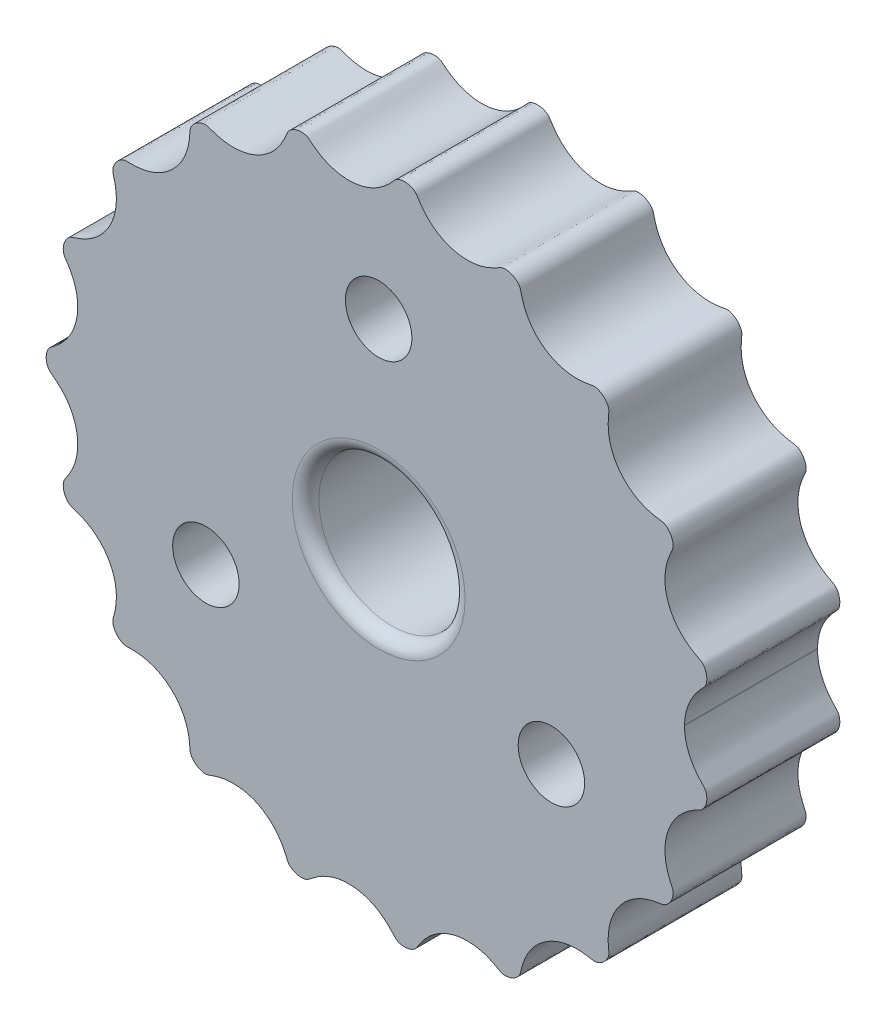
from build123d import *
from OCP.BRepAlgoAPI import BRepAlgoAPI_Cut
from OCP.TopTools import TopTools_ListOfShape

# Parameters (mm, degrees)
SKIZZE1_R                        = 25
AUFSATZ_LINEAR_AUSTRAGEN1_DEPTH  = 10
SCHNITT_LINEAR_AUSTRAGEN1_REACH  = 38.742
SKIZZE3_R                        = 0.5
SKIZZE9_OUTSIDE_W                = 66.282
SKIZZE9_OUTSIDE_H                = 66.277
SCHNITT_LINEAR_AUSTRAGEN6_DEPTH  = 10
SKIZZE21_R                       = 5.5
SCHNITT_LINEAR_AUSTRAGEN11_DEPTH = 10
VERRUNDUNG1_R                    = 1
SKIZZE22_R                       = 2.5
SCHNITT_LINEAR_AUSTRAGEN12_DEPTH = 10


with BuildPart() as part:
    # Skizze1 → Aufsatz-Linear austragen1 (new body)
    with BuildSketch(Plane.XY):
        Circle(SKIZZE1_R)
    extrude(amount=AUFSATZ_LINEAR_AUSTRAGEN1_DEPTH)

    # Skizze3 → Schnitt-Linear austragen1 (cut, up to next)
    with BuildSketch(Plane.XY.offset(10), mode=Mode.PRIVATE) as schnitt_linear_austragen1_sk1:
        with Locations((0, 25)):
            Circle(SKIZZE3_R)
    schnitt_linear_austragen1_tool1 = extrude(schnitt_linear_austragen1_sk1.sketch, amount=-SCHNITT_LINEAR_AUSTRAGEN1_REACH, mode=Mode.PRIVATE) & part.part
    add(schnitt_linear_austragen1_tool1.solids().sort_by_distance((0, 25, 10))[0], mode=Mode.SUBTRACT)


with BuildPart() as schnitt_linear_austragen6_tool:
    # Skizze9 outside → Schnitt-Linear austragen6 (new body)
    with BuildSketch(Plane.XY.offset(10)):
        with Locations((0, -0.0025)):
            Rectangle(SKIZZE9_OUTSIDE_W, SKIZZE9_OUTSIDE_H)
        with BuildLine():
            Line((23.000445052, 0.060937419), (23, 0))
            add(Edge.make_bspline(
                [(23, 0), (23, -0.044349008), (23.001634544, -0.133544535), (23.008990115, -0.322210424), (23.028574614, -0.495064366), (23.065190093, -0.760458288), (23.128344661, -1.048281187), (23.256601687, -1.483985708), (23.455853251, -1.931799386), (23.680914036, -2.313218321), (23.909870513, -2.622445518), (24.07431226, -2.824110253), (24.206727121, -2.972267331), (24.333633451, -3.108358174), (24.446736551, -3.225635305), (24.524022768, -3.315918282), (24.582950142, -3.415606662), (24.624575555, -3.520829648), (24.663833231, -3.668623209), (24.685212658, -3.860905388), (24.673454969, -4.086945135), (24.620520353, -4.306815249), (24.546445793, -4.484777086), (24.469451436, -4.614376883), (24.403672696, -4.702418772), (24.331050319, -4.778425537), (24.251571347, -4.839472504), (24.137679259, -4.903870311), (24.000097219, -4.973956943), (23.84602848, -5.056457749), (23.635223866, -5.176178294), (23.393295921, -5.329179221), (23.121190787, -5.527614354), (22.83161764, -5.779890288), (22.56554989, -6.056903088), (22.261697169, -6.436060568), (21.954792305, -6.933189392), (21.724897296, -7.481107687), (21.582883975, -8.065310431), (21.527316325, -8.563551076), (21.521604829, -8.970764731), (21.554125075, -9.36939933), (21.621771537, -9.756104532), (21.708688359, -10.081815143), (21.799454454, -10.348274513), (21.884205293, -10.563157843), (21.95582729, -10.729022258), (22.024783379, -10.882887471), (22.092422873, -11.024820073), (22.140398235, -11.174553681), (22.150406377, -11.346817537), (22.12742522, -11.544222174), (22.061014784, -11.76185876), (21.950504113, -11.978770955), (21.808294479, -12.167418182), (21.661405911, -12.302203337), (21.524713944, -12.391379973), (21.414032836, -12.43721046), (21.330064744, -12.458579008), (21.232109488, -12.476052218), (21.121185626, -12.492228868), (20.992061937, -12.512135255), (20.837428097, -12.539026465), (20.676348543, -12.570851463), (20.465515415, -12.619761983), (20.12052129, -12.717519847), (19.653901317, -12.897202897), (19.089906306, -13.210945732), (18.495681708, -13.693863685), (17.979768758, -14.303268377), (17.581791087, -15.018361732), (17.359944866, -15.712485613), (17.275839331, -16.272804376), (17.257885306, -16.675733613), (17.260289119, -16.912297659), (17.268312239, -17.087096877), (17.280219561, -17.249790236), (17.292103623, -17.381570247), (17.303701486, -17.494353717), (17.312264608, -17.59519884), (17.314827323, -17.684032965), (17.303731872, -17.784796247), (17.272764928, -17.89463724), (17.214331446, -18.035197831), (17.115684868, -18.199184234), (16.97055355, -18.369748736), (16.774094974, -18.530559906), (16.563256223, -18.644549245), (16.377147805, -18.704141919), (16.228010898, -18.718256331), (16.102397709, -18.706443721), (15.982650488, -18.684743591), (15.837019497, -18.658148732), (15.66401259, -18.629235343), (15.482546813, -18.604172907), (15.250492461, -18.580238466), (14.967572009, -18.565542892), (14.542882776, -18.572942029), (14.069257686, -18.636089462), (13.604258599, -18.755934349), (13.066613534, -18.966719819), (12.627823596, -19.205194372), (12.214900787, -19.503646661), (11.838876435, -19.858554155), (11.558257701, -20.183825318), (11.315746611, -20.530340865), (11.111529005, -20.892984657), (10.966201461, -21.21922683), (10.864967944, -21.499403505), (10.794070352, -21.732891274), (10.751061312, -21.893706864), (10.716991714, -22.032228461), (10.686714115, -22.158984424), (10.6596415, -22.274087772), (10.613482868, -22.409752989), (10.527338836, -22.535688011), (10.427360762, -22.644235621), (10.291112437, -22.758327008), (10.126481227, -22.862491763), (9.947040294, -22.939957105), (9.758065088, -22.988506338), (9.580990884, -23.009043361), (9.446037355, -23.007367015), (9.322218618, -22.98832781), (9.214984001, -22.94936695), (9.136712494, -22.910504045), (9.037412358, -22.855573454), (8.916331447, -22.786743456), (8.770400294, -22.708163136), (8.599394122, -22.621424072), (8.296890057, -22.482075538), (7.936423258, -22.348806181), (7.514581595, -22.240173425), (7.031331339, -22.175898472), (6.63282472, -22.160659511), (6.229783332, -22.183593355), (5.826015405, -22.24628189), (5.425311076, -22.349560047), (5.032027225, -22.494084861), (4.656518257, -22.676660873), (4.302267209, -22.894831043), (3.975506648, -23.142933834), (3.677721892, -23.416820254), (3.44405137, -23.674800098), (3.263982058, -23.904047687), (3.127014139, -24.097398487), (3.026037187, -24.249605204), (2.943370251, -24.379361317), (2.877121162, -24.486036845), (2.810740935, -24.57879713), (2.74416189, -24.652300533), (2.654279715, -24.721400662), (2.517169909, -24.800702807), (2.343070205, -24.869762739), (2.128967514, -24.917212113), (1.910391133, -24.925657676), (1.725434514, -24.904879453), (1.559739423, -24.86337266), (1.427196326, -24.812252919), (1.301753294, -24.737435115), (1.191905153, -24.625420932), (1.092920189, -24.51260355), (0.986207514, -24.3949086), (0.871449748, -24.27279856), (0.716656542, -24.117338482), (0.516618525, -23.934026062), (0.194350851, -23.67521298), (-0.281567512, -23.37339053), (-0.887269543, -23.103703015), (-1.633020944, -22.921923215), (-2.411936918, -22.880032942), (-3.183772753, -22.98328489), (-3.829023204, -23.195281934), (-4.2988972, -23.430962009), (-4.616564859, -23.630167647), (-4.823559306, -23.774552149), (-4.97774687, -23.891482046), (-5.119347714, -24.003691962), (-5.242224002, -24.103909003), (-5.336784037, -24.17043694), (-5.438268301, -24.218274505), (-5.542753751, -24.249603187), (-5.686937903, -24.275637376), (-5.871538478, -24.282233578), (-6.086374705, -24.256198966), (-6.293131419, -24.192746417), (-6.459711563, -24.112913075), (-6.600609431, -24.020448435), (-6.711181251, -23.927151216), (-6.796582984, -23.824147974), (-6.850770436, -23.71583568), (-6.898420406, -23.605777644), (-6.947365407, -23.488164192), (-7.008561783, -23.346866721), (-7.084251644, -23.183019072), (-7.185293459, -22.981995225), (-7.317773933, -22.747121988), (-7.49148797, -22.481034064), (-7.715928329, -22.192185427), (-7.968344871, -21.919017194), (-8.248406659, -21.665143187), (-8.561039816, -21.429310586), (-8.999973335, -21.15936401), (-9.485228438, -20.94396874), (-10.005750728, -20.794854161), (-10.5400902, -20.718700851), (-10.966382178, -20.701695058), (-11.385971488, -20.726307169), (-11.744136072, -20.781871828), (-12.040715619, -20.850768976), (-12.280072238, -20.919948378), (-12.464451491, -20.980432418), (-12.618960453, -21.034692841), (-12.744339362, -21.081252299), (-12.843197189, -21.112699229), (-12.914777695, -21.129342332), (-13.015493456, -21.140932804), (-13.160661859, -21.134055928), (-13.345844593, -21.094667271), (-13.56260646, -21.005188433), (-13.772683813, -20.869959052), (-13.946323804, -20.707939025), (-14.067019069, -20.543934653), (-14.143263724, -20.390738491), (-14.177226476, -20.250634214), (-14.186913508, -20.119401386), (-14.198440689, -19.946405008), (-14.213530015, -19.757442916), (-14.235675307, -19.559977047), (-14.274437993, -19.309568767), (-14.348423441, -18.950696656), (-14.498793866, -18.460238452), (-14.782089579, -17.861430032), (-15.234748365, -17.229911899), (-15.812344032, -16.679668351), (-16.491481174, -16.245685384), (-17.151171767, -15.98558094), (-17.688427228, -15.865276912), (-18.07785431, -15.818698105), (-18.344365358, -15.800803267), (-18.55154879, -15.796411929), (-18.747233389, -15.797098718), (-18.919214302, -15.801313033), (-19.042965023, -15.798032434), (-19.158541295, -15.774162573), (-19.263868768, -15.734188884), (-19.3980896, -15.664341865), (-19.552411122, -15.552423471), (-19.709792298, -15.394155651), (-19.835538635, -15.210365782), (-19.917456357, -15.039169872), (-19.969403098, -14.874816471), (-19.994190258, -14.740899926), (-19.994061908, -14.609119869), (-19.96216239, -14.459382142), (-19.920895394, -14.313172891), (-19.877538048, -14.147042514), (-19.822738803, -13.915360041), (-19.770338499, -13.638779931), (-19.729787287, -13.309541458), (-19.715499442, -12.931565797), (-19.734288413, -12.553576969), (-19.78648075, -12.177103437), (-19.872494472, -11.805088171), (-20.023495245, -11.347840311), (-20.235452427, -10.900740033), (-20.506081593, -10.477888045), (-20.831339838, -10.089797059), (-21.129561467, -9.798398433), (-21.449341767, -9.541949139), (-21.785901305, -9.320723048), (-22.090756042, -9.157591612), (-22.354079166, -9.039521408), (-22.57449546, -8.953373927), (-22.748877752, -8.891937388), (-22.912531083, -8.836937192), (-23.066356684, -8.789685219), (-23.212715882, -8.723861285), (-23.348770452, -8.613260744), (-23.480006336, -8.461017062), (-23.595931294, -8.263067795), (-23.680634411, -8.033492463), (-23.722308403, -7.802011304), (-23.721628367, -7.601527638), (-23.693635989, -7.437177019), (-23.645884227, -7.311299551), (-23.58698665, -7.21312039), (-23.50464466, -7.091898831), (-23.413480121, -6.955895234), (-23.316990468, -6.805530999), (-23.195404595, -6.600975755), (-23.068720652, -6.363313462), (-22.938312571, -6.075672915), (-22.783932861, -5.645082693), (-22.656015316, -5.100755854), (-22.599242968, -4.422068125), (-22.682573218, -3.620850866), (-22.927187084, -2.830849576), (-23.281762934, -2.183591871), (-23.6362768, -1.730779958), (-23.922117546, -1.436607135), (-24.101102734, -1.272218319), (-24.239026842, -1.154624124), (-24.371984778, -1.048237606), (-24.482308167, -0.963016223), (-24.57797062, -0.891541044), (-24.661991507, -0.827034417), (-24.732333337, -0.767244059), (-24.800898907, -0.690159367), (-24.861333187, -0.593231274), (-24.925032547, -0.457300089), (-24.978883512, -0.278375099), (-25.007975239, -0.061527264), (-24.998029137, 0.156872346), (-24.961603162, 0.339906687), (-24.906642074, 0.50012632), (-24.850441317, 0.615615614), (-24.783182463, 0.713841399), (-24.70612467, 0.790339655), (-24.641199481, 0.843342445), (-24.554870828, 0.908952697), (-24.448719227, 0.988664196), (-24.324236971, 1.08551779), (-24.183292784, 1.201125684), (-24.010485379, 1.353122041), (-23.81108179, 1.546943796), (-23.594560374, 1.787959427), (-23.371493508, 2.082915142), (-23.173407473, 2.397599431), (-23.002579424, 2.730283971), (-22.825060162, 3.168494616), (-22.696921594, 3.643219257), (-22.627743718, 4.144164769), (-22.624177416, 4.661685067), (-22.666363477, 5.09510154), (-22.751865401, 5.517351943), (-22.877747992, 5.924389933), (-23.019278499, 6.262452411), (-23.158709609, 6.535601458), (-23.284362722, 6.752410897), (-23.3882676, 6.916947859), (-23.488830891, 7.070166759), (-23.587535901, 7.210756821), (-23.671246821, 7.356766871), (-23.714168117, 7.530883328), (-23.726069468, 7.730855757), (-23.699502836, 7.95346433), (-23.630318379, 8.183104328), (-23.52633356, 8.390805115), (-23.408217078, 8.549040856), (-23.291190018, 8.662484079), (-23.187013266, 8.733895955), (-23.096821148, 8.775794948), (-22.981629081, 8.815868272), (-22.848401699, 8.858322888), (-22.69712753, 8.909663583), (-22.487141415, 8.985853442), (-22.243476665, 9.086475268), (-21.966172973, 9.220958126), (-21.659597337, 9.400507491), (-21.366019488, 9.606283221), (-21.015068462, 9.899172124), (-20.616439007, 10.319113026), (-20.277075182, 10.810519886), (-20.014381412, 11.363643533), (-19.854230856, 11.866250836), (-19.76733511, 12.278862528), (-19.722218727, 12.69227238), (-19.716907846, 13.102353212), (-19.745142047, 13.455174831), (-19.790240094, 13.74942761), (-19.839418258, 13.987801772), (-19.883928641, 14.171816656), (-19.924430221, 14.326336612), (-19.959635946, 14.452042245), (-19.981490611, 14.550865907), (-19.991146558, 14.621917303), (-19.993465617, 14.72171627), (-19.974186216, 14.864320272), (-19.919540962, 15.044506214), (-19.812527244, 15.25216623), (-19.679411984, 15.425448939), (-19.543747518, 15.55574001), (-19.401745818, 15.660735954), (-19.278658713, 15.729274103), (-19.150362589, 15.779380876), (-19.024594963, 15.798486978), (-18.926980599, 15.800538574), (-18.813257446, 15.799080978), (-18.683627696, 15.796922513), (-18.53204173, 15.796944362), (-18.31062943, 15.802325062), (-18.041284621, 15.820863743), (-17.724801817, 15.862809117), (-17.364733963, 15.94101113), (-16.917774924, 16.078626012), (-16.397352611, 16.308512891), (-15.823885698, 16.673447375), (-15.248465863, 17.213007475), (-14.783027937, 17.854203567), (-14.487819371, 18.482693114), (-14.3350991, 18.99858497), (-14.262711958, 19.375130086), (-14.226859149, 19.630575355), (-14.20749639, 19.827410906), (-14.193630668, 20.011616761), (-14.183967321, 20.173300433), (-14.169665264, 20.290528491), (-14.13620014, 20.400514429), (-14.087337219, 20.501498285), (-14.005949224, 20.629435105), (-13.880393847, 20.774171639), (-13.70771107, 20.918241132), (-13.512733191, 21.027567196), (-13.335015199, 21.093885416), (-13.164685419, 21.131095174), (-13.023217422, 21.144361796), (-12.881689292, 21.12758481), (-12.746913763, 21.081662976), (-12.631497009, 21.03976391), (-12.500061398, 20.992972587), (-12.351873906, 20.943093342), (-12.141323701, 20.87807499), (-11.86553961, 20.807502895), (-11.538863443, 20.746804727), (-11.161625373, 20.709663429), (-10.783309446, 20.705631746), (-10.303777308, 20.743163442), (-9.735365541, 20.858384867), (-9.18181952, 21.063324831), (-8.660831733, 21.356277131), (-8.259912327, 21.654194829), (-7.958145103, 21.92757187), (-7.687531539, 22.224301823), (-7.478169682, 22.501251308), (-7.318010029, 22.749249931), (-7.20056761, 22.955585939), (-7.116178939, 23.117827482), (-7.040056142, 23.277507391), (-6.979187413, 23.414280948), (-6.928975482, 23.532232778), (-6.882870247, 23.641734547), (-6.839615539, 23.742450967), (-6.773171762, 23.858311637), (-6.65282957, 23.982657264), (-6.491082256, 24.099618345), (-6.284788497, 24.198233347), (-6.048922103, 24.263470899), (-5.812488054, 24.285813995), (-5.613326656, 24.267901929), (-5.455447069, 24.226628527), (-5.347527378, 24.175192548), (-5.275554517, 24.127519588), (-5.196283273, 24.066745711), (-5.108397036, 23.995456259), (-5.005207665, 23.913288922), (-4.87956659, 23.816992501), (-4.745849829, 23.719619426), (-4.565670719, 23.597260564), (-4.257925449, 23.409520833), (-3.806481978, 23.188277614), (-3.189696877, 22.987508405), (-2.4297018, 22.881184216), (-1.632799656, 22.918771452), (-0.841139522, 23.113533128), (-0.185417958, 23.421013674), (0.279913741, 23.737791045), (0.586090336, 23.99639661), (0.75723351, 24.157626572), (0.879528328, 24.281299661), (0.990419271, 24.399613911), (1.078774774, 24.497056472), (1.153438544, 24.581504203), (1.221511196, 24.655596922), (1.284909504, 24.717121913), (1.365964253, 24.776451302), (1.466534589, 24.827405356), (1.607306031, 24.879028125), (1.791189755, 24.917323788), (2.010918157, 24.927456604), (2.228353918, 24.898176477), (2.407586515, 24.845650382), (2.563497119, 24.775949581), (2.678679926, 24.706441913), (2.777632399, 24.621649165), (2.853019608, 24.522023291), (2.908931221, 24.435321014), (2.974078542, 24.33121551), (3.051284656, 24.211060966), (3.167299359, 24.037823409), (3.331351344, 23.813630352), (3.541173762, 23.562291848), (3.803043157, 23.296719614), (4.086707511, 23.0547537), (4.391118971, 22.837513314), (4.714531329, 22.647175745), (5.143388574, 22.44428436), (5.609939139, 22.289692853), (6.103243803, 22.192847895), (6.613571115, 22.159739929), (7.039969066, 22.175523991), (7.45596771, 22.23304208), (7.857753737, 22.32901848), (8.19346564, 22.442983226), (8.465946947, 22.557985394), (8.684156853, 22.663374396), (8.851360353, 22.751583463), (9.006295735, 22.836489131), (9.148436637, 22.919582058), (9.30082606, 22.986899093), (9.45183871, 23.008270961), (9.59966399, 23.008128279), (9.776752969, 22.984634027), (9.965730297, 22.933371674), (10.144919716, 22.852814285), (10.309053586, 22.745466512), (10.44407308, 22.627824749), (10.53407695, 22.526397212), (10.603175592, 22.421236657), (10.6459465, 22.314934112), (10.669806717, 22.230421269), (10.69653886, 22.119567765), (10.728369147, 21.983278147), (10.769645086, 21.821863909), (10.822364317, 21.636487902), (10.926010427, 21.318121266), (11.074042685, 20.961211254), (11.282430556, 20.575963656), (11.565773855, 20.176091831), (11.827322448, 19.8724018), (12.119436256, 19.592389031), (12.44040703, 19.339697956), (12.876661539, 19.060768141), (13.347404564, 18.841416397), (13.841354543, 18.686544703), (14.346562303, 18.597669529), (14.697822311, 18.569296169), (14.998334673, 18.567816526), (15.242436954, 18.580630094), (15.431926482, 18.598274406), (15.616282199, 18.622023152), (15.795573094, 18.650999392), (15.962851102, 18.680431182), (16.118798238, 18.711409079), (16.263399958, 18.718550064), (16.391914742, 18.695708751), (16.543403207, 18.648374892), (16.712767044, 18.566287549), (16.893222658, 18.439957308), (17.047688615, 18.283639814), (17.157623063, 18.132363306), (17.238699297, 17.981533239), (17.290435538, 17.848540597), (17.318850043, 17.704467195), (17.309288654, 17.547054192), (17.293438171, 17.396783532), (17.279126309, 17.237718302), (17.26723479, 17.070006462), (17.258112105, 16.849933903), (17.259396139, 16.577416432), (17.288600546, 16.163150247), (17.391413432, 15.606121227), (17.607063674, 14.97582132), (17.98278944, 14.304662619), (18.482355126, 13.706633868), (19.081060914, 13.213737282), (19.671334612, 12.886965306), (20.160022126, 12.703434456), (20.519491246, 12.605928218), (20.764371272, 12.552105386), (20.953603627, 12.518237265), (21.13087845, 12.490311557), (21.286821711, 12.467902297), (21.399022085, 12.443218823), (21.502531078, 12.400834029), (21.596296463, 12.345018644), (21.713376754, 12.256098562), (21.843670156, 12.12380665), (21.970236318, 11.946885117), (22.06339444, 11.750449289), (22.117045015, 11.572589064), (22.143556613, 11.405366661), (22.148999212, 11.259824084), (22.129043967, 11.126677452), (22.084453838, 11.01317314), (22.035042439, 10.903006381), (21.981626051, 10.786711836), (21.91903893, 10.645419245), (21.84988298, 10.47817838), (21.770611386, 10.266643879), (21.68784118, 10.008603655), (21.610333735, 9.698628805), (21.550896661, 9.335505546), (21.522392058, 8.962605117), (21.527219116, 8.582673391), (21.578650743, 8.086551566), (21.697244437, 7.584617866), (21.886538483, 7.090537103), (22.145664856, 6.619857546), (22.390928041, 6.266159782), (22.666569586, 5.943750333), (22.967923595, 5.654097849), (23.25030844, 5.429986184), (23.500842393, 5.259692028), (23.712869035, 5.131359544), (23.881370584, 5.03731738), (24.02514823, 4.960864369), (24.143671879, 4.900496862), (24.233172759, 4.849199279), (24.293457338, 4.807893364), (24.370004649, 4.741544045), (24.46329889, 4.629697949), (24.559856625, 4.465993302), (24.640716486, 4.244664413), (24.682999507, 3.997236547), (24.68042987, 3.758616145), (24.640301905, 3.558001792), (24.577641328, 3.397875329), (24.495553822, 3.278627925), (24.404839843, 3.182652043), (24.285118601, 3.056518562), (24.155837943, 2.916518174), (24.025294341, 2.765947581), (23.866886198, 2.565736427), (23.65265004, 2.267267024), (23.441960579, 1.901904987), (23.254560312, 1.474212846), (23.132014183, 1.060832925), (23.07056542, 0.786083879), (23.033498116, 0.534909185), (23.013150116, 0.367843981), (23.003809227, 0.188906137), (23.00106448, 0.103341973), (23.000445052, 0.060937419)],
                knots=[0.061461869, 0.061461869, 0.061461869, 0.061461869, 0.061461869, 0.062481445, 0.063501022, 0.064520599, 0.065540176, 0.067576099, 0.069612021, 0.073551422, 0.075470515, 0.076430061, 0.077389608, 0.078784848, 0.079482469, 0.080180089, 0.080675989, 0.08117189, 0.081811292, 0.082450694, 0.08375265, 0.085055896, 0.086348118, 0.086985531, 0.087622943, 0.088090233, 0.088557523, 0.089098343, 0.089639163, 0.090720802, 0.091672036, 0.09262327, 0.094525737, 0.096489951, 0.098454164, 0.100356812, 0.10225946, 0.10627407, 0.110193456, 0.112266353, 0.11433925, 0.11636582, 0.118392389, 0.12031835, 0.122244311, 0.123154673, 0.124065035, 0.124975397, 0.125885759, 0.126557793, 0.127229826, 0.128129419, 0.129330025, 0.130553094, 0.131784273, 0.133020441, 0.134060738, 0.134556345, 0.135051953, 0.13542865, 0.135805347, 0.136558742, 0.137312136, 0.13806553, 0.138967838, 0.139870147, 0.141674763, 0.145291833, 0.149024214, 0.152819048, 0.157032102, 0.161293195, 0.165413803, 0.167416944, 0.168418515, 0.169420086, 0.17018247, 0.170944853, 0.171707237, 0.172088429, 0.172469621, 0.172982902, 0.173496183, 0.174127309, 0.174758435, 0.17604715, 0.177334859, 0.178622361, 0.179842068, 0.180858382, 0.181239448, 0.181620514, 0.182382646, 0.18330634, 0.184230034, 0.185153729, 0.186077423, 0.188008327, 0.18993923, 0.193707134, 0.195683354, 0.197659574, 0.20156597, 0.203742577, 0.205919184, 0.20806606, 0.210212936, 0.212255549, 0.214298162, 0.215256984, 0.216215807, 0.21717463, 0.217654041, 0.218133452, 0.218844998, 0.219556544, 0.220526996, 0.221172682, 0.221818368, 0.223129836, 0.224442242, 0.225090176, 0.225738109, 0.226716692, 0.227156221, 0.227595749, 0.228035278, 0.228474807, 0.229441441, 0.230408075, 0.231374709, 0.232341343, 0.236155051, 0.238142566, 0.24013008, 0.242156938, 0.244183795, 0.24626956, 0.248355325, 0.25048654, 0.252617754, 0.25467391, 0.256730066, 0.258746558, 0.260763049, 0.261683387, 0.262603725, 0.263524064, 0.264444402, 0.264788533, 0.265132665, 0.265820928, 0.266439844, 0.267058759, 0.268319629, 0.269581881, 0.270836146, 0.271447043, 0.272057939, 0.273020901, 0.273690799, 0.274360697, 0.275205248, 0.276049798, 0.276894349, 0.2777389, 0.279628283, 0.281517665, 0.285218833, 0.289070237, 0.292926287, 0.296908335, 0.300855043, 0.304679262, 0.30654518, 0.307478139, 0.308411098, 0.309767191, 0.310445237, 0.311123283, 0.311606737, 0.312090192, 0.312701594, 0.313312996, 0.314554765, 0.315800337, 0.317040482, 0.317652611, 0.31826474, 0.319193909, 0.319946353, 0.320322575, 0.320698797, 0.321608324, 0.322517851, 0.323427377, 0.324336904, 0.326144367, 0.327951831, 0.329827833, 0.331703834, 0.333633724, 0.335563614, 0.337712362, 0.342077456, 0.344293801, 0.346434782, 0.348575763, 0.35066526, 0.352754757, 0.353732581, 0.354710404, 0.355688228, 0.356666052, 0.357036209, 0.357406366, 0.357776523, 0.35814668, 0.359078007, 0.360317761, 0.361577487, 0.362842327, 0.364094692, 0.365071945, 0.365667398, 0.366262852, 0.366989275, 0.367715697, 0.369168542, 0.370082205, 0.370995868, 0.372823194, 0.376552803, 0.38039774, 0.384282664, 0.388402025, 0.39253995, 0.396544231, 0.398493694, 0.399468425, 0.400443157, 0.401928453, 0.402671102, 0.40341375, 0.403913987, 0.404414225, 0.405044338, 0.405674452, 0.406957862, 0.408242485, 0.409517363, 0.410142295, 0.410767227, 0.411714908, 0.412247239, 0.41277957, 0.413844232, 0.4147777, 0.415711168, 0.417578104, 0.419518186, 0.421458267, 0.423328359, 0.425198451, 0.427172202, 0.429145952, 0.433023392, 0.43514143, 0.437259467, 0.439338207, 0.441416947, 0.443392934, 0.445368921, 0.446300588, 0.447232254, 0.448163921, 0.449095588, 0.449784402, 0.450473216, 0.451382192, 0.452593709, 0.453825325, 0.455063918, 0.456298746, 0.45730289, 0.457852187, 0.458401483, 0.459002613, 0.459603742, 0.460806002, 0.461704818, 0.462603633, 0.464401265, 0.466233534, 0.468065804, 0.471816322, 0.475642391, 0.479892351, 0.484207442, 0.48837624, 0.490424009, 0.491447893, 0.492471777, 0.493274866, 0.494077956, 0.494881045, 0.49528259, 0.495684135, 0.496211548, 0.496738961, 0.497357205, 0.497975449, 0.499231578, 0.500491381, 0.501743384, 0.50236159, 0.502979796, 0.503901788, 0.504323365, 0.504744942, 0.505166519, 0.505588096, 0.506506968, 0.507425839, 0.50834471, 0.509263581, 0.511146457, 0.513029333, 0.514869914, 0.516710496, 0.518634982, 0.520559469, 0.524389865, 0.526592624, 0.528795383, 0.530975029, 0.533154675, 0.535263554, 0.537372432, 0.53835327, 0.539334108, 0.540314945, 0.541295783, 0.542048107, 0.542800431, 0.543686288, 0.544870456, 0.546075751, 0.547288506, 0.548504624, 0.549524184, 0.550040358, 0.550556531, 0.551041008, 0.551525485, 0.55249444, 0.553378094, 0.554261748, 0.556029056, 0.557807622, 0.559586189, 0.561417743, 0.563249298, 0.567012976, 0.571225708, 0.573386361, 0.575547015, 0.577630159, 0.579713304, 0.581758364, 0.583803424, 0.584757415, 0.585711405, 0.586665396, 0.587619386, 0.587980597, 0.588341808, 0.588703018, 0.589064229, 0.589990986, 0.591225742, 0.592481897, 0.59374487, 0.59437508, 0.595005289, 0.596034993, 0.596580579, 0.597126165, 0.597562516, 0.597998867, 0.598871569, 0.599744271, 0.600616973, 0.602464647, 0.60431232, 0.606174746, 0.608037171, 0.611882783, 0.615747661, 0.619804001, 0.623847233, 0.627760176, 0.629667042, 0.630620475, 0.631573908, 0.632960263, 0.63365344, 0.634346617, 0.634839622, 0.635332626, 0.635965359, 0.636598093, 0.63788999, 0.639180695, 0.640471372, 0.641083557, 0.641695743, 0.642695231, 0.643314822, 0.643934412, 0.644554003, 0.645173594, 0.646129545, 0.647085497, 0.648997399, 0.650909523, 0.652821646, 0.654718686, 0.656615725, 0.660595184, 0.664475995, 0.66655082, 0.668625645, 0.670649627, 0.672673608, 0.674635575, 0.675616559, 0.676597542, 0.677459594, 0.678321645, 0.679183697, 0.679614722, 0.680045748, 0.680717948, 0.681390147, 0.682294064, 0.683500503, 0.684729773, 0.685967267, 0.687210114, 0.68825602, 0.68874479, 0.68923356, 0.689613898, 0.689994235, 0.690754909, 0.691515583, 0.692276257, 0.69318362, 0.694090983, 0.695905709, 0.699541039, 0.703294389, 0.707104333, 0.711296015, 0.715529056, 0.719622991, 0.721613785, 0.722609182, 0.723604579, 0.724362502, 0.725120424, 0.725878347, 0.726257308, 0.726636269, 0.727146511, 0.727656752, 0.728277518, 0.728898283, 0.730163027, 0.731428819, 0.732686728, 0.733300114, 0.733913501, 0.734868188, 0.73538728, 0.735906371, 0.736425463, 0.736944554, 0.73786553, 0.738786506, 0.740628457, 0.742543985, 0.744459512, 0.746297797, 0.748136082, 0.750075712, 0.752015342, 0.755850354, 0.758013558, 0.760176761, 0.762308008, 0.764439255, 0.766466447, 0.768493639, 0.769446296, 0.770398953, 0.771351609, 0.772304266, 0.773010518, 0.77371677, 0.774692014, 0.775340978, 0.775989942, 0.777308168, 0.778627356, 0.779278498, 0.779929639, 0.7809117, 0.781353356, 0.781795012, 0.782236668, 0.782678324, 0.783649926, 0.784621528, 0.785593129, 0.786564731, 0.79039886, 0.792397566, 0.794396271, 0.796431969, 0.798467667, 0.800543572, 0.802619477, 0.806855275, 0.808898188, 0.810941102, 0.812947147, 0.813950169, 0.814953191, 0.815868189, 0.816783186, 0.817698184, 0.818613182, 0.819297292, 0.819981402, 0.820603238, 0.821225074, 0.822491763, 0.823759871, 0.825019489, 0.825633476, 0.826247462, 0.827207841, 0.827885659, 0.828563477, 0.829410873, 0.830258269, 0.831105665, 0.83195306, 0.833851593, 0.835750126, 0.839469591, 0.84334196, 0.847211812, 0.851171733, 0.855089792, 0.858887816, 0.860741655, 0.861668574, 0.862595494, 0.863942523, 0.864616038, 0.865289552, 0.865770228, 0.866250904, 0.866865514, 0.867480124, 0.868728307, 0.869980404, 0.871226481, 0.871842593, 0.872458706, 0.873390393, 0.874149913, 0.874529673, 0.874909433, 0.875821436, 0.876733439, 0.877645443, 0.878557446, 0.880375808, 0.88219417, 0.884080941, 0.885967711, 0.887906445, 0.889845178, 0.894123322, 0.896327099, 0.898530875, 0.900658637, 0.902786399, 0.904865784, 0.90694517, 0.907917553, 0.908889936, 0.909862318, 0.910834701, 0.911202796, 0.911570891, 0.911938986, 0.912307081, 0.913242964, 0.914488698, 0.9157545, 0.91702529, 0.918282922, 0.919265523, 0.919863292, 0.920461062, 0.921190028, 0.921918995, 0.923376927, 0.924296159, 0.92521539, 0.927053853, 0.930802192, 0.932735308, 0.934668424, 0.935643402, 0.93661838, 0.937593358, 0.938568336, 0.938568336, 0.938568336, 0.938568336, 0.938568336], degree=4))
        make_face(mode=Mode.SUBTRACT)
    extrude(amount=-SCHNITT_LINEAR_AUSTRAGEN6_DEPTH)


with BuildPart() as part_1:
    add(part.part)

    # Schnitt-Linear austragen6: cut by schnitt_linear_austragen6_tool, with a tolerance
    schnitt_linear_austragen6_stock = TopTools_ListOfShape()
    schnitt_linear_austragen6_stock.Append(part_1.part.wrapped)
    schnitt_linear_austragen6_tools = TopTools_ListOfShape()
    schnitt_linear_austragen6_tools.Append(schnitt_linear_austragen6_tool.part.wrapped)
    schnitt_linear_austragen6_cut = BRepAlgoAPI_Cut()
    schnitt_linear_austragen6_cut.SetArguments(schnitt_linear_austragen6_stock)
    schnitt_linear_austragen6_cut.SetTools(schnitt_linear_austragen6_tools)
    schnitt_linear_austragen6_cut.SetFuzzyValue(0.00001)
    schnitt_linear_austragen6_cut.Build()
    add(Compound.cast(schnitt_linear_austragen6_cut.Shape()).solids(), mode=Mode.REPLACE)

    # Skizze21 → Schnitt-Linear austragen11 (cut)
    with BuildSketch(Plane(origin=(0, 0, 0), x_dir=(-1, 0, 0), z_dir=(0, 0, -1))):
        Circle(SKIZZE21_R)
    extrude(amount=-SCHNITT_LINEAR_AUSTRAGEN11_DEPTH, mode=Mode.SUBTRACT)

    # Verrundung1
    verrundung1_edges = [part_1.edges().sort_by_distance(p)[0] for p in [
        (5.5, 0, 0),
        (5.5, 0, 10),
    ]]
    fillet(verrundung1_edges, radius=VERRUNDUNG1_R)

    # Skizze22 → Schnitt-Linear austragen12 (cut)
    with BuildSketch(Plane(origin=(0, 0, 0), x_dir=(-1, 0, 0), z_dir=(0, 0, -1))):
        with Locations((0, 15)):
            Circle(SKIZZE22_R)
        with Locations((12.990381057, -7.5)):
            Circle(SKIZZE22_R)
        with Locations((-12.990381057, -7.5)):
            Circle(SKIZZE22_R)
    extrude(amount=-SCHNITT_LINEAR_AUSTRAGEN12_DEPTH, mode=Mode.SUBTRACT)


solid = part_1.part
